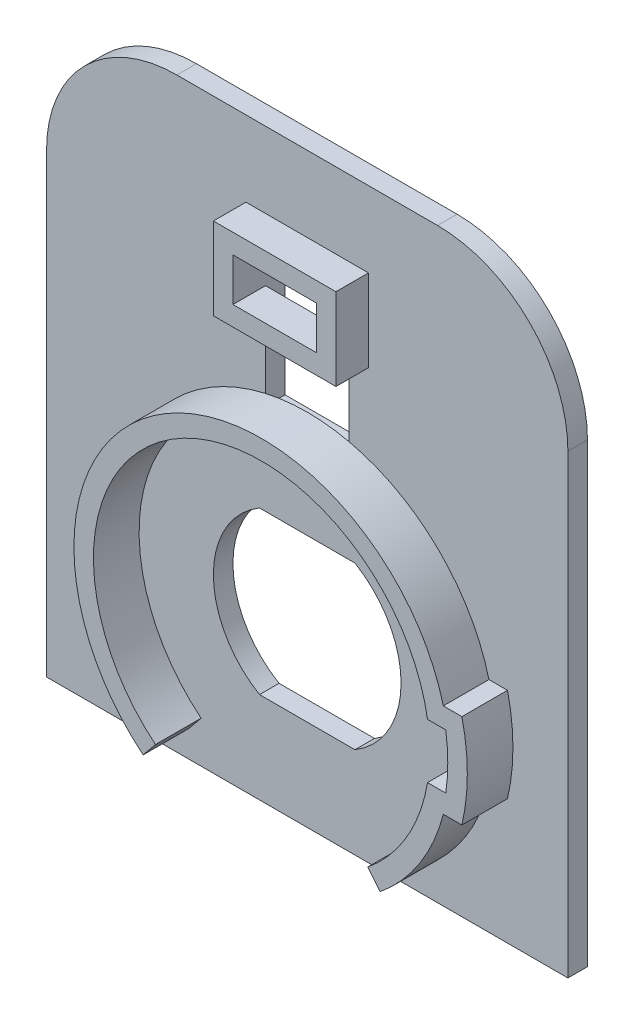
from build123d import *

# Parameters (mm, degrees)
CROQUIS1_W                  = 40
CROQUIS1_H                  = 45
CROQUIS1_W_2                = 6.4
CROQUIS1_H_2                = 11.3
SALIENTE_EXTRUIR1_DEPTH     = 1.5
REDONDEO1_R                 = 10
EXTRUIR_L_MINA1_OUTLINE_W   = 9.4
EXTRUIR_L_MINA1_OUTLINE_H   = 6.3
EXTRUIR_L_MINA1_OUTLINE_W_2 = 6.4
EXTRUIR_L_MINA1_OUTLINE_H_2 = 3.3
EXTRUIR_L_MINA1_DEPTH       = 4
EXTRUIR_L_MINA3_DEPTH       = 5
CROQUIS1_10_W               = 6.4
CROQUIS1_10_H               = 8
CORTAR_EXTRUIR5_DEPTH       = 1.5


# Read off the part's stored shape, not the designer's step: Extruir-Lámina1
with BuildPart() as part:
    # Croquis1 → Saliente-Extruir1 (new body)
    with BuildSketch(Plane.XY):
        with Locations((0, 9.3)):
            Rectangle(CROQUIS1_W, CROQUIS1_H)
        with BuildLine():
            Line((3.660601044, -6.2), (-3.660601044, -6.2))
            ThreePointArc((-3.660601044, -6.2), (-7.2, 0), (-3.660601044, 6.2))
            Line((-3.660601044, 6.2), (3.660601044, 6.2))
            ThreePointArc((3.660601044, 6.2), (7.2, 0), (3.660601044, -6.2))
        make_face(mode=Mode.SUBTRACT)
        with Locations((0, 18.85)):
            Rectangle(CROQUIS1_W_2, CROQUIS1_H_2, mode=Mode.SUBTRACT)
    extrude(amount=SALIENTE_EXTRUIR1_DEPTH)

    # Redondeo1
    redondeo1_edges = [part.edges().sort_by_distance(p)[0] for p in [
        (-20, 31.8, 0.75),
        (20, 31.8, 0.75),
    ]]
    fillet(redondeo1_edges, radius=REDONDEO1_R)

    # Extruir-Lámina1 outline → Extruir-Lámina1 (add)
    with BuildSketch(Plane.XY):
        with Locations((0, 22.85)):
            Rectangle(EXTRUIR_L_MINA1_OUTLINE_W, EXTRUIR_L_MINA1_OUTLINE_H)
        with Locations((0, 22.85)):
            Rectangle(EXTRUIR_L_MINA1_OUTLINE_W_2, EXTRUIR_L_MINA1_OUTLINE_H_2, mode=Mode.SUBTRACT)
    extrude(amount=EXTRUIR_L_MINA1_DEPTH)

    # Croquis1<11> → Extruir-Lámina3 (add)
    with BuildSketch(Plane.XY):
        with BuildLine():
            ThreePointArc((-8.140559831, -10.007061788), (-6.473500548, 11.158126664), (12.727922061, 2.1))
            Line((12.727922061, 2.1), (14.127922061, 2.1))
            ThreePointArc((14.127922061, 2.1), (14.283143274, 0), (14.127922061, -2.1))
            Line((14.127922061, -2.1), (12.727922061, -2.1))
            ThreePointArc((12.727922061, -2.1), (11.158126664, -6.473500548), (8.140559831, -10.007061788))
            Line((8.140559831, -10.007061788), (9.087136556, -11.170673624))
            ThreePointArc((9.087136556, -11.170673624), (12.121162438, -7.774150831), (13.942740046, -3.6))
            Line((13.942740046, -3.6), (15.367095093, -3.6))
            ThreePointArc((15.367095093, -3.6), (15.783143274, 0), (15.367095093, 3.6))
            Line((15.367095093, 3.6), (13.942740046, 3.6))
            ThreePointArc((13.942740046, 3.6), (-7.774150831, 12.121162438), (-9.087136556, -11.170673624))
            Line((-9.087136556, -11.170673624), (-8.140559831, -10.007061788))
        make_face()
    extrude(amount=EXTRUIR_L_MINA3_DEPTH)

    # Croquis1<10> → Cortar-Extruir5 (cut)
    with BuildSketch(Plane.XY):
        with Locations((0, 17.2)):
            Rectangle(CROQUIS1_10_W, CROQUIS1_10_H)
    extrude(amount=CORTAR_EXTRUIR5_DEPTH, mode=Mode.SUBTRACT)


solid = part.part
